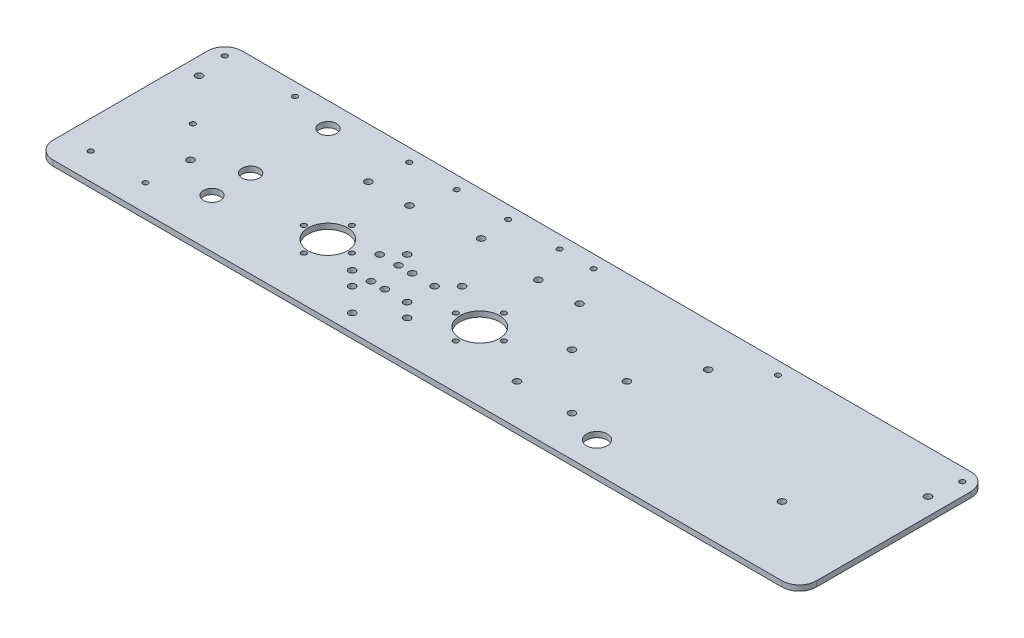
from build123d import *

# Parameters (mm, degrees)
SKETCH1_R           = 2
SKETCH1_R_2         = 1.5
SKETCH1_R_3         = 6
SKETCH1_R_4         = 11.5
BOSS_EXTRUDE1_DEPTH = 3.175
FILLET1_R           = 10
SKETCH2_R           = 2
CUT_EXTRUDE1_DEPTH  = 10
SKETCH3_R           = 2
CUT_EXTRUDE2_DEPTH  = 10
SKETCH4_R           = 1.5
SKETCH4_R_2         = 2
CUT_EXTRUDE3_DEPTH  = 6.35
SKETCH5_R           = 5
CUT_EXTRUDE4_DEPTH  = 3.175


with BuildPart() as part:
    # Sketch1 → Boss-Extrude1 (new body)
    with BuildSketch(Plane(origin=(0, 0, 0), x_dir=(1, 0, 0), z_dir=(0, 1, 0))):
        Polygon((-26.799577535, 0), (417.700422465, 0), (417.700422465, 17.22815868), (417.700422465, 110), (-26.799577535, 110), align=None)
        with Locations((23.200422465, 40)):
            Circle(SKETCH1_R, mode=Mode.SUBTRACT)
        with Locations((89.200422465, 40)):
            Circle(SKETCH1_R_2, mode=Mode.SUBTRACT)
        with Locations((103.200422465, 26)):
            Circle(SKETCH1_R_2, mode=Mode.SUBTRACT)
        with Locations((117.200422465, 40)):
            Circle(SKETCH1_R_2, mode=Mode.SUBTRACT)
        with Locations((177.700422465, 40)):
            Circle(SKETCH1_R_2, mode=Mode.SUBTRACT)
        with Locations((191.700422465, 26)):
            Circle(SKETCH1_R_2, mode=Mode.SUBTRACT)
        with Locations((205.700422465, 40)):
            Circle(SKETCH1_R_2, mode=Mode.SUBTRACT)
        with Locations((367.700422465, 40)):
            Circle(SKETCH1_R, mode=Mode.SUBTRACT)
        with Locations((147.450422465, 10)):
            Circle(SKETCH1_R, mode=Mode.SUBTRACT)
        with Locations((282.700422465, 17.22815868)):
            Circle(SKETCH1_R_3, mode=Mode.SUBTRACT)
        with Locations((-16.799577535, 85)):
            Circle(SKETCH1_R, mode=Mode.SUBTRACT)
        with Locations((147.450422465, 85)):
            Circle(SKETCH1_R, mode=Mode.SUBTRACT)
        with Locations((103.200422465, 54)):
            Circle(SKETCH1_R_2, mode=Mode.SUBTRACT)
        with Locations((103.200422465, 40)):
            Circle(SKETCH1_R_4, mode=Mode.SUBTRACT)
        with Locations((279.700422465, 85)):
            Circle(SKETCH1_R, mode=Mode.SUBTRACT)
        with Locations((191.700422465, 54)):
            Circle(SKETCH1_R_2, mode=Mode.SUBTRACT)
        with Locations((191.700422465, 40)):
            Circle(SKETCH1_R_4, mode=Mode.SUBTRACT)
        with Locations((407.700422465, 85)):
            Circle(SKETCH1_R, mode=Mode.SUBTRACT)
        with Locations((-19.299577535, 102.5)):
            Circle(SKETCH1_R_2, mode=Mode.SUBTRACT)
        with Locations((88.075422465, 102.5)):
            Circle(SKETCH1_R_2, mode=Mode.SUBTRACT)
        with Locations((195.450422465, 102.5)):
            Circle(SKETCH1_R_2, mode=Mode.SUBTRACT)
        with Locations((302.825422465, 102.5)):
            Circle(SKETCH1_R_2, mode=Mode.SUBTRACT)
        with Locations((410.200422465, 102.5)):
            Circle(SKETCH1_R_2, mode=Mode.SUBTRACT)
    extrude(amount=BOSS_EXTRUDE1_DEPTH)

    # Fillet1
    fillet1_edges = [part.edges().sort_by_distance(p)[0] for p in [
        (417.700422465, 1.5875, -110),
        (417.700422465, 1.5875, 0),
        (-26.799577535, 1.5875, 0),
        (-26.799577535, 1.5875, -110),
    ]]
    fillet(fillet1_edges, radius=FILLET1_R)

    # Sketch2 → Cut-Extrude1 (cut)
    with BuildSketch(Plane(origin=(0, 3.175, 0), x_dir=(1, 0, 0), z_dir=(0, 1, 0))):
        with Locations((133.950422465, 55.40559892)):
            Circle(SKETCH2_R)
        with Locations((165.950422465, 55.40559892)):
            Circle(SKETCH2_R)
        with Locations((133.950422465, 23.40559892)):
            Circle(SKETCH2_R)
        with Locations((165.950422465, 23.40559892)):
            Circle(SKETCH2_R)
        with Locations((157.950422465, 31.40559892)):
            Circle(SKETCH2_R)
        with Locations((125.950422465, 31.40559892)):
            Circle(SKETCH2_R)
        with Locations((125.950422465, 47.40559892)):
            Circle(SKETCH2_R)
        with Locations((157.950422465, 47.40559892)):
            Circle(SKETCH2_R)
    extrude(amount=-CUT_EXTRUDE1_DEPTH, mode=Mode.SUBTRACT)

    # Sketch3 → Cut-Extrude2 (cut)
    with BuildSketch(Plane.XZ):
        with Locations((136.950422465, -47.40559892)):
            Circle(SKETCH3_R)
        with Locations((144.950422465, -31.40559892)):
            Circle(SKETCH3_R)
        with Locations((136.950422465, -31.40559892)):
            Circle(SKETCH3_R)
        with Locations((144.950422465, -47.40559892)):
            Circle(SKETCH3_R)
        with Locations((229.950422465, -55.40559892)):
            Circle(SKETCH3_R)
        with Locations((229.950422465, -23.40559892)):
            Circle(SKETCH3_R)
        with Locations((261.950422465, -23.40559892)):
            Circle(SKETCH3_R)
        with Locations((261.950422465, -55.40559892)):
            Circle(SKETCH3_R)
    extrude(amount=-CUT_EXTRUDE2_DEPTH, mode=Mode.SUBTRACT)

    # Sketch4 → Cut-Extrude3 (cut)
    with BuildSketch(Plane(origin=(0, 3.175, 0), x_dir=(1, 0, 0), z_dir=(0, 1, 0))):
        with Locations((21.590660574, 102.5)):
            Circle(SKETCH4_R)
        with Locations((5.664827234, 58.95279946)):
            Circle(SKETCH4_R)
        with Locations((-10.261006106, 15.40559892)):
            Circle(SKETCH4_R)
        with Locations((47.350422465, 50.90559892)):
            Circle(SKETCH4_R_2)
        with Locations((115.670834955, 102.5)):
            Circle(SKETCH4_R)
        with Locations((145.670834955, 102.5)):
            Circle(SKETCH4_R)
        with Locations((175.670834955, 102.5)):
            Circle(SKETCH4_R)
        with Locations((47.350422465, 95.90559892)):
            Circle(SKETCH4_R_2)
        with Locations((21.590660574, 15.40559892)):
            Circle(SKETCH4_R)
        with Locations((47.350422465, 28.40559892)):
            Circle(SKETCH4_R_2)
        with Locations((208.950422465, 80.80559892)):
            Circle(SKETCH4_R_2)
        with Locations((184.950422465, 80.80559892)):
            Circle(SKETCH4_R_2)
        with Locations((109.950422465, 80.80559892)):
            Circle(SKETCH4_R_2)
        with Locations((85.950422465, 80.80559892)):
            Circle(SKETCH4_R_2)
    extrude(amount=-CUT_EXTRUDE3_DEPTH, mode=Mode.SUBTRACT)

    # Sketch5 → Cut-Extrude4 (cut)
    with BuildSketch(Plane(origin=(0, 3.175, 0), x_dir=(1, 0, 0), z_dir=(0, 1, 0))):
        with Locations((47.350422465, 95.90559892)):
            Circle(SKETCH5_R)
        with Locations((47.350422465, 50.90559892)):
            Circle(SKETCH5_R)
        with Locations((47.350422465, 28.40559892)):
            Circle(SKETCH5_R)
    extrude(amount=-CUT_EXTRUDE4_DEPTH, mode=Mode.SUBTRACT)


solid = part.part
